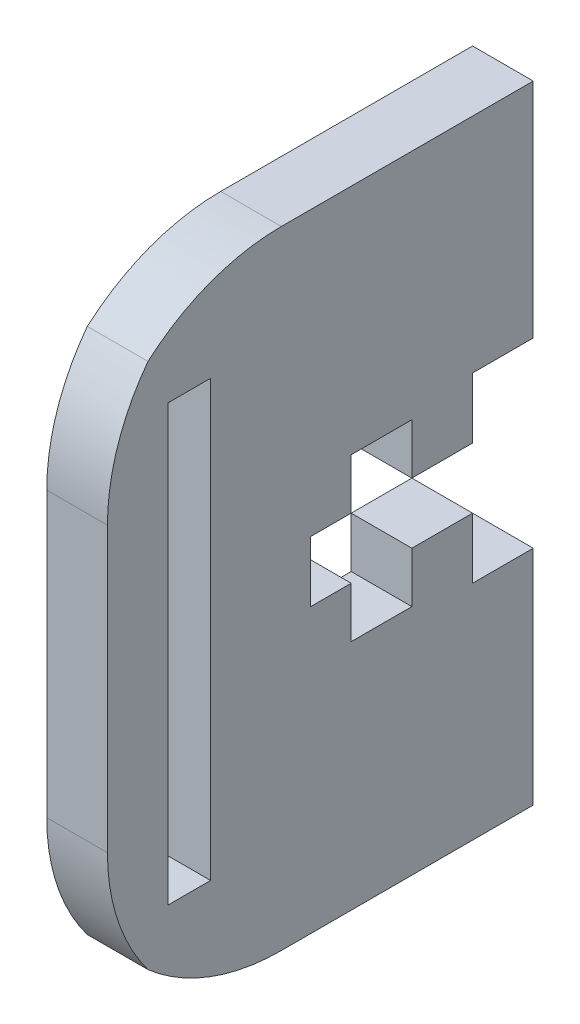
from build123d import *

# Parameters (mm, degrees)
CROQUIS1_W              = 2.1
CROQUIS1_H              = 21.5
SALIENTE_EXTRUIR1_DEPTH = 1.5
REDONDEO1_R             = 10
CROQUIS2_W              = 3
CROQUIS2_H              = 17
SALIENTE_EXTRUIR2_DEPTH = 3
CROQUIS3_W              = 3
CROQUIS3_H              = 17
SALIENTE_EXTRUIR3_DEPTH = 3
REDONDEO2_R             = 10
REDONDEO3_R             = 10
CROQUIS5_W              = 21.447905668
CROQUIS5_H              = 38.241159468
CORTAR_EXTRUIR2_DEPTH   = 10
REDONDEO4_R             = 10
CORTAR_EXTRUIR3_DEPTH   = 10


with BuildPart() as part:
    # Croquis1 → Saliente-Extruir1 (new, symmetric)
    with BuildSketch(Plane(origin=(0, 0, 0), x_dir=(0, 0, -1), z_dir=(1, 0, 0))):
        Polygon((14, -12.5), (17, -12.5), (17, -4.5), (14, -4.5), (14, 4.5), (17, 4.5), (17, 12.5), (-10, 12.5), (-10, -12.5), align=None)
        Rectangle(CROQUIS1_W, CROQUIS1_H, mode=Mode.SUBTRACT)
    extrude(amount=SALIENTE_EXTRUIR1_DEPTH, both=True)

    # Redondeo1
    redondeo1_edges = [part.edges().sort_by_distance(p)[0] for p in [
        (0, -12.5, 10),
        (0, 12.5, 10),
    ]]
    fillet(redondeo1_edges, radius=REDONDEO1_R)

    # Croquis2 → Saliente-Extruir2 (add)
    with BuildSketch(Plane(origin=(0, 12.5, 0), x_dir=(1, 0, 0), z_dir=(0, 1, 0))):
        with Locations((0, 8.5)):
            Rectangle(CROQUIS2_W, CROQUIS2_H)
    extrude(amount=SALIENTE_EXTRUIR2_DEPTH)

    # Croquis3 → Saliente-Extruir3 (add)
    with BuildSketch(Plane.XZ.offset(12.5)):
        with Locations((0, -8.5)):
            Rectangle(CROQUIS3_W, CROQUIS3_H)
    extrude(amount=SALIENTE_EXTRUIR3_DEPTH)

    # Redondeo2
    # the kernel refuses this fillet: 10 mm, written as the material it adds along each edge
    with BuildSketch(Plane(origin=(1.5, -12.5, 0), x_dir=(0, -1, 0), z_dir=(-1, 0, 0))) as redondeo2_piece_1:
        with BuildLine():
            CenterArc((8.038461538, 8.637934089), REDONDEO2_R, 205.587990121, 34.157222478)
            Line((-0.980769231, 4.318967044), (-1.161153846, 4.232587704))
            ThreePointArc((-1.161153846, 4.232587704), (-0.443308828, 2.17017369), (-0.2, 0))
            Line((-0.2, 0), (0, -0.2))
            ThreePointArc((0, -0.2), (1.5, -0.2), (2.899230769, -0.172758682))
            Line((2.899230769, -0.172758682), (3, 0))
        make_face()
    extrude(amount=3)
    with BuildSketch(Plane(origin=(1.5, 12.5, 0), x_dir=(0, 1, 0), z_dir=(-1, 0, 0))) as redondeo2_piece_2:
        with BuildLine():
            CenterArc((8.038461538, -8.637934089), REDONDEO2_R, 120.254787401, 34.157222478)
            Line((-0.980769231, -4.318967044), (-1.161153846, -4.232587704))
            ThreePointArc((-1.161153846, -4.232587704), (-0.443308828, -2.17017369), (-0.2, 0))
            Line((-0.2, 0), (0, 0.2))
            ThreePointArc((0, 0.2), (1.5, 0.2), (2.899230769, 0.172758682))
            Line((2.899230769, 0.172758682), (3, 0))
        make_face()
    extrude(amount=3)

    # Redondeo3
    redondeo3_edges = [part.edges().sort_by_distance(p)[0] for p in [
        (0, 15.5, 0),
        (0, -15.5, 0),
    ]]
    fillet(redondeo3_edges, radius=REDONDEO3_R)

    # Croquis5 → Cortar-Extruir2 (cut)
    with BuildSketch(Plane(origin=(1.5, 0, 0), x_dir=(0, 0, -1), z_dir=(1, 0, 0))):
        with Locations((-14.773952834, -0.867042995)):
            Rectangle(CROQUIS5_W, CROQUIS5_H)
    extrude(amount=-CORTAR_EXTRUIR2_DEPTH, mode=Mode.SUBTRACT)

    # Redondeo4
    # the kernel refuses this fillet: 10 mm, written as the material it takes off along each edge
    with BuildSketch(Plane(origin=(-13.099738715, 11.653031847, 4.05), x_dir=(0, 0.5631802476031196, -0.8263340781485954), z_dir=(1, 0, 0))) as redondeo4_piece_1:
        with BuildLine():
            CenterArc((5.650243293, -9.465906235), REDONDEO4_R, 108.810422247, 36.913558107)
            Line((-2.613097489, -3.834103759), (-2.778364304, -3.72146771))
            Line((-2.778364304, -3.72146771), (-0.165266816, 0.11263605))
            Line((-0.165266816, 0.11263605), (0.024258644, 0.198523344))
            ThreePointArc((0.024258644, 0.198523344), (1.212932207, 0.126167209), (2.361376837, 0.189318125))
            Line((2.361376837, 0.189318125), (2.425864415, 0))
        make_face()
    extrude(amount=26.19947743, mode=Mode.SUBTRACT)
    with BuildSketch(Plane(origin=(-13.099738715, -11.653031847, 4.05), x_dir=(0, 1, 0), z_dir=(1, 0, 0))) as redondeo4_piece_2:
        with BuildLine():
            CenterArc((4.639895486, -10), REDONDEO4_R, 90, 36.913558107)
            Line((-1.366198922, -2.004574435), (-1.48632081, -1.844665924))
            ThreePointArc((-1.48632081, -1.844665924), (-0.787355725, -0.931232338), (-0.177708594, 0.091758682))
            Line((-0.177708594, 0.091758682), (0, 0.2))
            Line((0, 0.2), (4.639895486, 0.2))
            Line((4.639895486, 0.2), (4.639895486, 0))
        make_face()
    extrude(amount=26.19947743, mode=Mode.SUBTRACT)

    # Croquis6 → Cortar-Extruir3 (cut)
    with BuildSketch(Plane(origin=(1.5, 0, 0), x_dir=(0, 0, -1), z_dir=(1, 0, 0))):
        Polygon((14, 1.5), (11, 1.5), (11, 4), (8, 4), (8, 1.5), (6, 1.5), (6, -1.5), (8, -1.5), (8, -4), (11, -4), (11, -1.5), (14, -1.5), align=None)
    extrude(amount=-CORTAR_EXTRUIR3_DEPTH, mode=Mode.SUBTRACT)


solid = part.part
